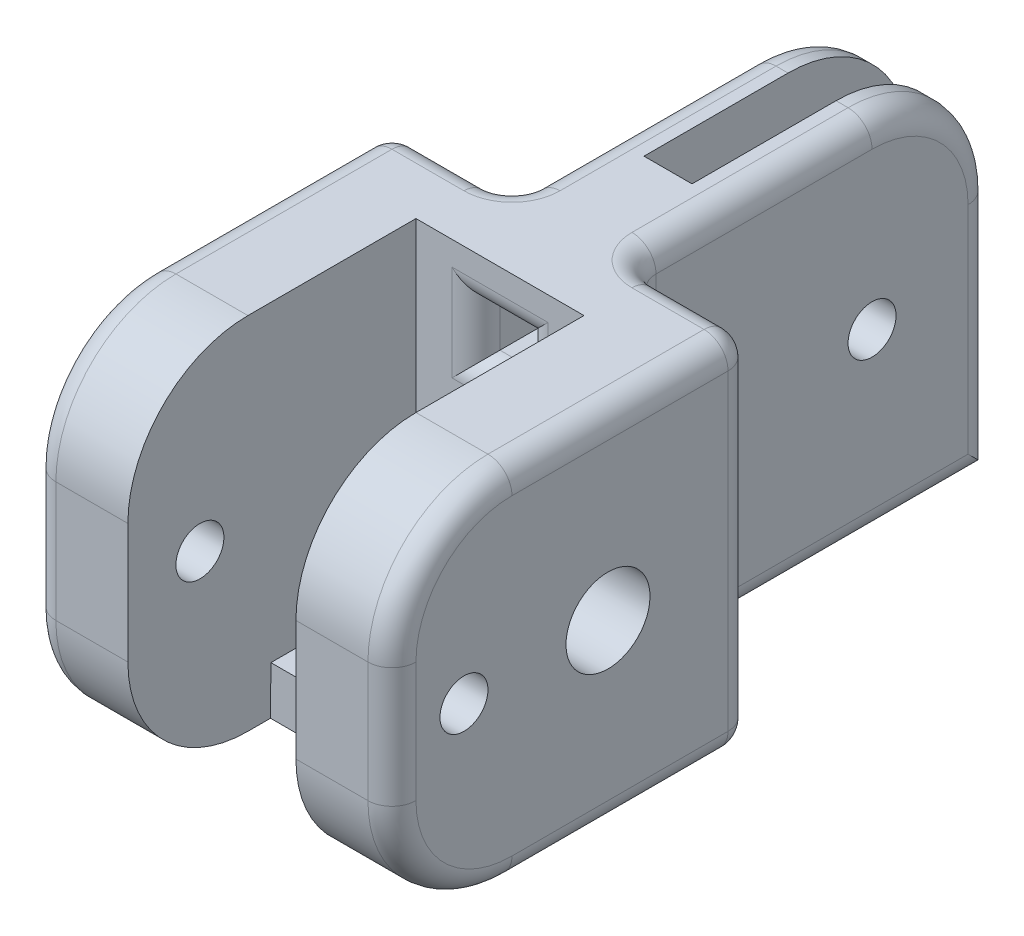
from build123d import *

# Parameters (mm, degrees)
BASE_SKETCH_W                        = 15
BASE_SKETCH_H                        = 15
BASE_SKETCH_EXTRUDE_DEPTH            = 30
CENTER_NUB_CUTOUT_SKETCH_W           = 5
CENTER_NUB_CUTOUT_SKETCH_H           = 15
HINGE_NUB_EXTRUDED_CUT_DEPTH         = 15
HINGE_CUTOUT_SKETCH_W                = 7
HINGE_CUTOUT_SKETCH_H                = 15
HINGE_CUTOUT_EXTRUDED_CUT_DEPTH      = 12
HINGE_HOLE_SKETCH_R                  = 1
HINGE_HOLE_EXTRUDED_CUT_DEPTH        = 35.369317712
CORNER_FILLETS_R                     = 5
STYLE_FILLETS_R                      = 1
ROUTING_HOLES_SKETCH_W               = 2
ROUTING_HOLES_SKETCH_H               = 2
ROUTING_HOLES_EXTRUDED_CUT_DEPTH     = 32.819805153
BACKING_START                        = -3.5
BACKING_EXTRUDE_DEPTH                = 7
EXTRA_ROUTING_CUT_SKETCH_W           = 2
EXTRA_ROUTING_CUT_SKETCH_H           = 10
EXTRA_ROUTING_EXTRUDED_CUT_DEPTH     = 4
ROUTING_FILLETS_R                    = 1
SKETCH2_R                            = 1.75
MIDDLE_SECTION_CONNECTION_HOLE_DEPTH = 3


# Read off the part's stored shape, not the designer's step: Backing Extrude
with BuildPart() as part:
    # Base Sketch → Base Sketch Extrude (new body)
    with BuildSketch(Plane.XY):
        Rectangle(BASE_SKETCH_W, BASE_SKETCH_H)
    extrude(amount=BASE_SKETCH_EXTRUDE_DEPTH)

    # Center Nub Cutout Sketch → Hinge Nub Extruded Cut (cut)
    with BuildSketch(Plane.XY):
        with Locations((5, 0)):
            Rectangle(CENTER_NUB_CUTOUT_SKETCH_W, CENTER_NUB_CUTOUT_SKETCH_H)
        with Locations((-5, 0)):
            Rectangle(CENTER_NUB_CUTOUT_SKETCH_W, CENTER_NUB_CUTOUT_SKETCH_H)
    extrude(amount=HINGE_NUB_EXTRUDED_CUT_DEPTH, mode=Mode.SUBTRACT)

    # Hinge Cutout Sketch → Hinge Cutout Extruded Cut (cut)
    with BuildSketch(Plane.XY.offset(30)):
        Rectangle(HINGE_CUTOUT_SKETCH_W, HINGE_CUTOUT_SKETCH_H)
    extrude(amount=-HINGE_CUTOUT_EXTRUDED_CUT_DEPTH, mode=Mode.SUBTRACT)

    # Hinge Hole Sketch → Hinge Hole Extruded Cut (cut, through all)
    with BuildSketch(Plane(origin=(7.5, 0, 0), x_dir=(0, 0, -1), z_dir=(1, 0, 0))):
        with Locations(Location((-5, 0, 0), (0, 0, 90))):
            Circle(HINGE_HOLE_SKETCH_R)
        with Locations(Location((-27, 0, 0), (0, 0, 90))):
            Circle(HINGE_HOLE_SKETCH_R)
    extrude(amount=-HINGE_HOLE_EXTRUDED_CUT_DEPTH, mode=Mode.SUBTRACT)

    # Corner Fillets
    corner_fillets_edges = [part.edges().sort_by_distance(p)[0] for p in [
        (0, 7.5, 0),
        (-5.5, -7.5, 30),
        (-5.5, 7.5, 30),
        (5.5, -7.5, 30),
        (5.5, 7.5, 30),
    ]]
    fillet(corner_fillets_edges, radius=CORNER_FILLETS_R)

    # Style Fillets
    style_fillets_edges = [part.edges().sort_by_distance(p)[0] for p in [
        (2.5, 7.5, 10),
        (2.5, -7.5, 7.5),
        (7.5, 0, 15),
        (5, 7.5, 15),
        (2.5, 0, 15),
        (5, -7.5, 15),
        (-2.5, -2.5, 0),
        (-2.5, -7.5, 7.5),
        (-2.5, 7.5, 10),
        (-7.5, 0, 15),
        (-5, -7.5, 15),
        (-2.5, 0, 15),
        (-5, 7.5, 15),
        (-7.5, 0, 30),
        (-7.5, -7.5, 20),
        (7.5, -7.5, 20),
        (-7.5, 7.5, 20),
        (-7.5, 6.035533906, 28.535533906),
        (-7.5, -6.035533906, 28.535533906),
        (7.5, 7.5, 20),
        (7.5, 0, 30),
        (7.5, 6.035533906, 28.535533906),
        (7.5, -6.035533906, 28.535533906),
        (-2.5, 6.035533906, 1.464466094),
        (2.5, -2.5, 0),
        (2.5, 6.035533906, 1.464466094),
    ]]
    fillet(style_fillets_edges, radius=STYLE_FILLETS_R)

    # Routing Holes Sketch → Routing Holes Extruded Cut (cut, through all)
    with BuildSketch(Plane.XY):
        with Locations((0, 4.5)):
            Rectangle(ROUTING_HOLES_SKETCH_W, ROUTING_HOLES_SKETCH_H)
        with Locations((0, -4.5)):
            Rectangle(ROUTING_HOLES_SKETCH_W, ROUTING_HOLES_SKETCH_H)
    extrude(amount=ROUTING_HOLES_EXTRUDED_CUT_DEPTH, mode=Mode.SUBTRACT)

    # Backing Extrude outline → Backing Extrude (add)
    with BuildSketch(Plane.YZ.offset(BACKING_START)):
        Polygon((-7.5, 24.05884149), (-7.5, 18), (-5.5, 18), (-5.5, 24.043125728), align=None)
    extrude(amount=BACKING_EXTRUDE_DEPTH)

    # Extra Routing Cut Sketch → Extra Routing Extruded Cut (cut)
    with BuildSketch(Plane(origin=(0, 7.5, 0), x_dir=(1, 0, 0), z_dir=(0, 1, 0))):
        with Locations((0, -6)):
            Rectangle(EXTRA_ROUTING_CUT_SKETCH_W, EXTRA_ROUTING_CUT_SKETCH_H)
    extrude(amount=-EXTRA_ROUTING_EXTRUDED_CUT_DEPTH, mode=Mode.SUBTRACT)

    # Routing Fillets
    routing_fillets_edges = [part.edges().sort_by_distance(p)[0] for p in [
        (-1, -4.5, 18),
        (0, -3.5, 18),
        (1, -4.5, 18),
        (-1, 4.5, 18),
        (0, 3.5, 18),
        (1, 4.5, 18),
        (0, 5.5, 18),
        (0, -5.5, 0),
        (0, -3.5, 0),
        (0, 5.5, 11),
    ]]
    fillet(routing_fillets_edges, radius=ROUTING_FILLETS_R)

    # Sketch2 → Middle Section Connection Hole (cut)
    with BuildSketch(Plane(origin=(7.5, 0, 0), x_dir=(0, 0, -1), z_dir=(1, 0, 0))):
        with Locations(Location((-21, 0, 0), (0, 0, 90))):
            Circle(SKETCH2_R)
    middle_section_connection_hole = extrude(amount=-MIDDLE_SECTION_CONNECTION_HOLE_DEPTH, mode=Mode.SUBTRACT)

    # Mirror1: Middle Section Connection Hole across plane
    add(middle_section_connection_hole.mirror(Plane(origin=(0, 0, 0), x_dir=(0, 0, 1), z_dir=(1, 0, 0))), mode=Mode.SUBTRACT)


solid = part.part
